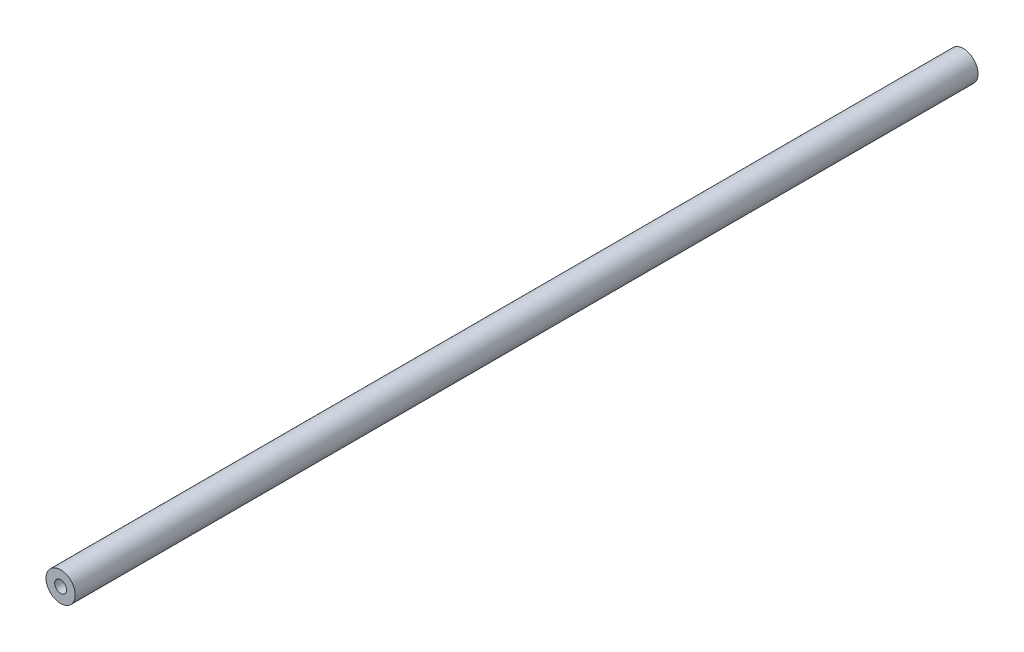
from build123d import *

# Parameters (mm, degrees)
SKETCH1_R                      = 6.4
BOSS_EXTRUDE1_DEPTH            = 395
F_6_0_204_DIAMETER_HOLE1_D     = 5.1816
F_6_0_204_DIAMETER_HOLE1_DEPTH = 30
F_6_0_204_DIAMETER_HOLE1_TIP   = 1.556709692
F_6_0_204_DIAMETER_HOLE2_D     = 5.1816
F_6_0_204_DIAMETER_HOLE2_DEPTH = 30
F_6_0_204_DIAMETER_HOLE2_TIP   = 1.556709692


with BuildPart() as part:
    # Sketch1 → Boss-Extrude1 (new body)
    with BuildSketch(Plane.XY):
        Circle(SKETCH1_R)
    extrude(amount=BOSS_EXTRUDE1_DEPTH)

    # #6 (0.204) Diameter Hole1
    with Locations(Plane(origin=(0, 0, 0), x_dir=(-1, 0, 0), z_dir=(0, 0, -1))):
        with Locations((0, 0)):
            Hole(F_6_0_204_DIAMETER_HOLE1_D / 2, depth=F_6_0_204_DIAMETER_HOLE1_DEPTH)
            with Locations((0, 0, -(F_6_0_204_DIAMETER_HOLE1_DEPTH + F_6_0_204_DIAMETER_HOLE1_TIP / 2))):  # 118° drill point
                Cone(0, F_6_0_204_DIAMETER_HOLE1_D / 2, F_6_0_204_DIAMETER_HOLE1_TIP, mode=Mode.SUBTRACT)

    # #6 (0.204) Diameter Hole2
    with Locations(Plane.XY.offset(395)):
        with Locations((0, 0)):
            Hole(F_6_0_204_DIAMETER_HOLE2_D / 2, depth=F_6_0_204_DIAMETER_HOLE2_DEPTH)
            with Locations((0, 0, -(F_6_0_204_DIAMETER_HOLE2_DEPTH + F_6_0_204_DIAMETER_HOLE2_TIP / 2))):  # 118° drill point
                Cone(0, F_6_0_204_DIAMETER_HOLE2_D / 2, F_6_0_204_DIAMETER_HOLE2_TIP, mode=Mode.SUBTRACT)


solid = part.part
